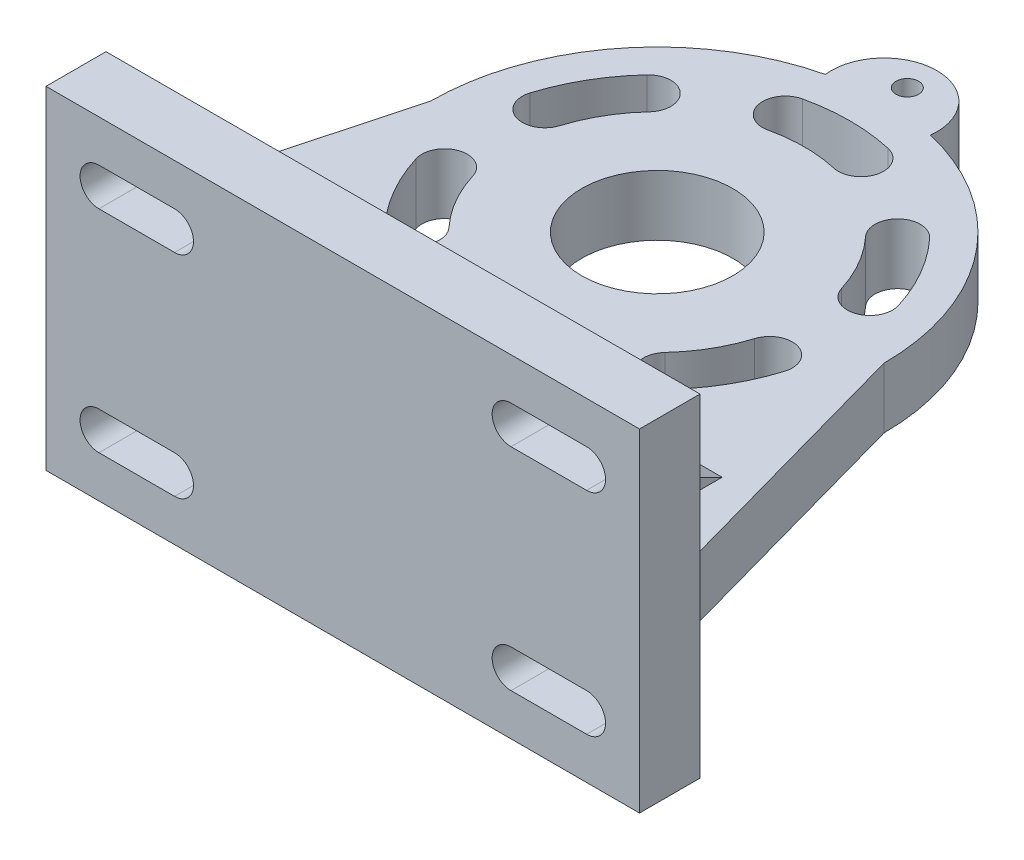
from build123d import *

# Parameters (mm, degrees)
SKETCH1_R                = 30
BOSS_EXTRUDE1_DEPTH      = 8
SKETCH10_R               = 10
CUT_EXTRUDE3_DEPTH       = 10
BOSS_EXTRUDE2_START      = -8
BOSS_EXTRUDE2_DEPTH      = 8
BOSS_EXTRUDE3_DEPTH      = 18
BOSS_EXTRUDE3_DEPTH_BACK = 26
RIB22_REACH              = 86.319
SKETCH15_WALL_W          = 181.819095046
SKETCH15_WALL_H          = 6
BOSS_EXTRUDE4_START      = -8
SKETCH16_R               = 1.5
BOSS_EXTRUDE4_DEPTH      = 8
CUT_EXTRUDE4_DEPTH       = 8


with BuildPart() as part:
    # Sketch1 → Boss-Extrude1 (new body)
    with BuildSketch(Plane(origin=(0, 0, 0), x_dir=(1, 0, 0), z_dir=(0, 1, 0))):
        Circle(SKETCH1_R)
    extrude(amount=BOSS_EXTRUDE1_DEPTH)

    # Sketch10 → Cut-Extrude3 (cut)
    with BuildSketch(Plane(origin=(0, 8, 0), x_dir=(1, 0, 0), z_dir=(0, 1, 0))):
        Circle(SKETCH10_R)
        with BuildLine():
            ThreePointArc((5.666666667, 24.862399098), (0, 25.5), (-5.666666667, 24.862399098))
            ThreePointArc((-5.666666667, 24.862399098), (-7.924988129, 21.270744302), (-4.333333333, 19.012422839))
            ThreePointArc((-4.333333333, 19.012422839), (0, 19.5), (4.333333333, 19.012422839))
            ThreePointArc((4.333333333, 19.012422839), (7.924988129, 21.270744302), (5.666666667, 24.862399098))
        make_face()
        with BuildLine():
            ThreePointArc((24.364802551, 7.523722261), (22.083647797, 12.75), (18.698135884, 17.338676837))
            ThreePointArc((18.698135884, 17.338676837), (14.458510858, 17.498613195), (14.2985745, 13.258988169))
            ThreePointArc((14.2985745, 13.258988169), (16.887495374, 9.75), (18.631907833, 5.75343467))
            ThreePointArc((18.631907833, 5.75343467), (22.383498987, 3.772131106), (24.364802551, 7.523722261))
        make_face()
        with BuildLine():
            ThreePointArc((18.698135884, -17.338676837), (22.083647797, -12.75), (24.364802551, -7.523722261))
            ThreePointArc((24.364802551, -7.523722261), (22.383498987, -3.772131106), (18.631907833, -5.75343467))
            ThreePointArc((18.631907833, -5.75343467), (16.887495374, -9.75), (14.2985745, -13.258988169))
            ThreePointArc((14.2985745, -13.258988169), (14.458510858, -17.498613195), (18.698135884, -17.338676837))
        make_face()
        with BuildLine():
            ThreePointArc((-5.666666667, -24.862399098), (0, -25.5), (5.666666667, -24.862399098))
            ThreePointArc((5.666666667, -24.862399098), (7.924988129, -21.270744302), (4.333333333, -19.012422839))
            ThreePointArc((4.333333333, -19.012422839), (0, -19.5), (-4.333333333, -19.012422839))
            ThreePointArc((-4.333333333, -19.012422839), (-7.924988129, -21.270744302), (-5.666666667, -24.862399098))
        make_face()
        with BuildLine():
            ThreePointArc((-24.364802551, -7.523722261), (-22.083647797, -12.75), (-18.698135884, -17.338676837))
            ThreePointArc((-18.698135884, -17.338676837), (-14.458510858, -17.498613195), (-14.2985745, -13.258988169))
            ThreePointArc((-14.2985745, -13.258988169), (-16.887495374, -9.75), (-18.631907833, -5.75343467))
            ThreePointArc((-18.631907833, -5.75343467), (-22.383498987, -3.772131106), (-24.364802551, -7.523722261))
        make_face()
        with BuildLine():
            ThreePointArc((-18.698135884, 17.338676837), (-22.083647797, 12.75), (-24.364802551, 7.523722261))
            ThreePointArc((-24.364802551, 7.523722261), (-22.383498987, 3.772131106), (-18.631907833, 5.75343467))
            ThreePointArc((-18.631907833, 5.75343467), (-16.887495374, 9.75), (-14.2985745, 13.258988169))
            ThreePointArc((-14.2985745, 13.258988169), (-14.458510858, 17.498613195), (-18.698135884, 17.338676837))
        make_face()
    extrude(amount=-CUT_EXTRUDE3_DEPTH, mode=Mode.SUBTRACT)

    # Sketch12 → Boss-Extrude2 (add)
    with BuildSketch(Plane(origin=(0, 8, 0), x_dir=(1, 0, 0), z_dir=(0, 1, 0)).offset(BOSS_EXTRUDE2_START)):
        with BuildLine():
            ThreePointArc((30, 0), (0, -30), (-30, 0))
            Line((-30, 0), (-39.132149187, -33.787628671))
            Line((-39.132149187, -33.787628671), (39.373960889, -33.721341273))
            Line((39.373960889, -33.721341273), (30, 0))
        make_face()
    extrude(amount=BOSS_EXTRUDE2_DEPTH)

    # Sketch13 → Boss-Extrude3 (add, two sides: drawn at the far end of the back side and taken through both)
    with BuildSketch(Plane(origin=(0, 8, 0), x_dir=(1, 0, 0), z_dir=(0, 1, 0)).offset(-BOSS_EXTRUDE3_DEPTH_BACK)):
        Polygon((-39.132149187, -33.787628671), (39.373960889, -33.721341273), (39.373960889, -41.721341273), (-39.132149187, -41.721341273), align=None)
    extrude(amount=BOSS_EXTRUDE3_DEPTH + BOSS_EXTRUDE3_DEPTH_BACK)

    # Sketch15 wall → Rib22 (add, up to next)
    with BuildSketch(Plane(origin=(-29.132149187, 10.5, 28.787628671), x_dir=(0, 0.4472135955, 0.894427191), z_dir=(0, 0.894427191, -0.4472135955)), mode=Mode.PRIVATE) as rib22_sk1:
        Rectangle(SKETCH15_WALL_W, SKETCH15_WALL_H)
    rib22_tool1 = extrude(rib22_sk1.sketch, amount=-RIB22_REACH, mode=Mode.PRIVATE) - part.part
    rib22 = rib22_tool1.solids().sort_by_distance((-29.132149187, 10.5, 28.787628671))[0]
    add(rib22)

    # Mirror1: Rib22 across plane
    add(rib22.mirror(Plane.ZY.offset(-0.120905851)))

    # Sketch16 → Boss-Extrude4 (add)
    with BuildSketch(Plane(origin=(0, 8, 0), x_dir=(1, 0, 0), z_dir=(0, 1, 0)).offset(BOSS_EXTRUDE4_START)):
        with BuildLine():
            ThreePointArc((6.952197894, 29.183333333), (0, 37), (-6.952197894, 29.183333333))
            ThreePointArc((-6.952197894, 29.183333333), (0, 30), (6.952197894, 29.183333333))
        make_face()
        with Locations((0, 33.074498835)):
            Circle(SKETCH16_R, mode=Mode.SUBTRACT)
    extrude(amount=BOSS_EXTRUDE4_DEPTH)

    # Sketch17 → Cut-Extrude4 (cut)
    with BuildSketch(Plane(origin=(0.028500994, 0, 33.754562995), x_dir=(-0.9999996435285086, 0, 0.0008443594353065629), z_dir=(-0.0008443594353065629, 0, -0.9999996435285086))):
        with BuildLine():
            Line((-32.345471426, 20.469812005), (-22.345471426, 20.469812005))
            ThreePointArc((-22.345471426, 20.469812005), (-19.845471426, 17.969812005), (-22.345471426, 15.469812005))
            Line((-22.345471426, 15.469812005), (-32.345471426, 15.469812005))
            ThreePointArc((-32.345471426, 15.469812005), (-34.845471426, 17.969812005), (-32.345471426, 20.469812005))
        make_face()
        with BuildLine():
            Line((32.160661645, 20.469812005), (22.160661645, 20.469812005))
            ThreePointArc((22.160661645, 20.469812005), (19.660661645, 17.969812005), (22.160661645, 15.469812005))
            Line((22.160661645, 15.469812005), (32.160661645, 15.469812005))
            ThreePointArc((32.160661645, 15.469812005), (34.660661645, 17.969812005), (32.160661645, 20.469812005))
        make_face()
        with BuildLine():
            Line((32.160661645, -12.469812005), (22.160661645, -12.469812005))
            ThreePointArc((22.160661645, -12.469812005), (19.660661645, -9.969812005), (22.160661645, -7.469812005))
            Line((22.160661645, -7.469812005), (32.160661645, -7.469812005))
            ThreePointArc((32.160661645, -7.469812005), (34.660661645, -9.969812005), (32.160661645, -12.469812005))
        make_face()
        with BuildLine():
            Line((-32.345471426, -12.469812005), (-22.345471426, -12.469812005))
            ThreePointArc((-22.345471426, -12.469812005), (-19.845471426, -9.969812005), (-22.345471426, -7.469812005))
            Line((-22.345471426, -7.469812005), (-32.345471426, -7.469812005))
            ThreePointArc((-32.345471426, -7.469812005), (-34.845471426, -9.969812005), (-32.345471426, -12.469812005))
        make_face()
    extrude(amount=-CUT_EXTRUDE4_DEPTH, mode=Mode.SUBTRACT)


solid = part.part
